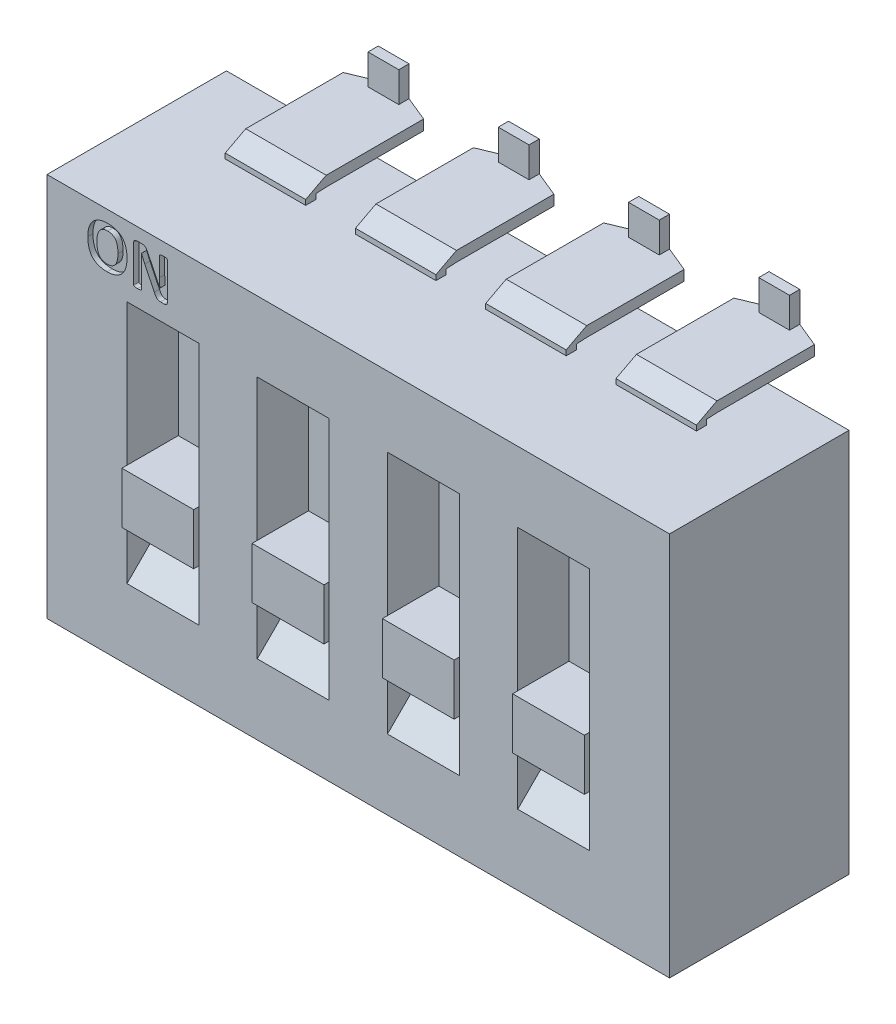
from build123d import *

# Parameters (mm, degrees)
SKETCH_1_W                         = 12.14
SKETCH_1_H                         = 7.5
EXTRUDE_1_DEPTH                    = 3.5
SKETCH_2_W                         = 1.57
SKETCH_2_H                         = 0.2
EXTRUDE_2_DEPTH                    = 0.1
SKETCH_3_W                         = 0.6
SKETCH_3_H                         = 0.79
EXTRUDE_3_DEPTH                    = 0.2
SKETCH_4_W                         = 1.57
SKETCH_4_H                         = 0.2
EXTRUDE_4_DEPTH                    = 1.9
CHAMFER_1_SIZE                     = 0.2
CHAMFER_1_SIZE_2                   = 0.485
LOFT_START                         = -4.595
LOFT_1_DEPTH                       = 1.57
SKETCH_5_W                         = 1.4
SKETCH_5_H                         = 2.76
CUT_EXTRUDE_1_DEPTH                = 1
CHAMFER_2_SIZE                     = 1
SKETCH_6_W                         = 1.4
SKETCH_6_H                         = 1
EXTRUDE_5_DEPTH                    = 1.1
PATTERN_LINEAR_3_COUNT             = 4
PATTERN_LINEAR_3_PITCH             = 2.54
CHAMFER_2_OF_PATTERN_LINEAR_3_SIZE = 1
PATTERN_LINEAR_1_COUNT             = 4
PATTERN_LINEAR_1_PITCH             = 2.54
CUT_EXTRUDE_2_DEPTH                = 0.1


# Read off the part's stored shape, not the designer's step: По сечениям1
# Some blends are built 0.0001 mm under size
with BuildPart() as part:
    # Эскиз1 → Бобышка-Вытянуть1 (new body)
    with BuildSketch(Plane.XY.offset(1)):
        Rectangle(SKETCH_1_W, SKETCH_1_H)
    extrude(amount=EXTRUDE_1_DEPTH)

    # Эскиз5 → Вырез-Вытянуть1 (cut)
    with BuildSketch(Plane.XY.offset(4.5)):
        with Locations((-3.81, 0)):
            Rectangle(SKETCH_5_W, SKETCH_5_H)
    cut_extrude_1 = extrude(amount=-CUT_EXTRUDE_1_DEPTH, mode=Mode.SUBTRACT)

    # Фаска2
    chamfer_2_edges = [part.edges().sort_by_distance(p)[0] for p in [
        (-3.81, 1.38, 4.5),
        (-3.81, -1.38, 4.5),
    ]]
    chamfer(chamfer_2_edges, length=CHAMFER_2_SIZE - 0.0001)  # a hair under: the kernel refuses the full size

    # Линейный массив3: Вырез-Вытянуть1 ×4
    with Locations(*[(i * PATTERN_LINEAR_3_PITCH, 0, 0) for i in range(1, PATTERN_LINEAR_3_COUNT)]):
        add(cut_extrude_1, mode=Mode.SUBTRACT)

    # Фаска2 of Линейный массив3
    chamfer_2_of_pattern_linear_3_edges = [part.edges().sort_by_distance(p)[0] for p in [
        (-1.27, 1.38, 4.5),
        (-1.27, -1.38, 4.5),
        (1.27, 1.38, 4.5),
        (1.27, -1.38, 4.5),
        (3.81, 1.38, 4.5),
        (3.81, -1.38, 4.5),
    ]]
    chamfer(chamfer_2_of_pattern_linear_3_edges, length=CHAMFER_2_OF_PATTERN_LINEAR_3_SIZE - 0.0001)  # a hair under: the kernel refuses the full size

    # Эскиз7 → Вырез-Вытянуть2 (cut)
    # profile 1 of 2: a face of its own
    with BuildSketch(Plane.XY.offset(4.5)):
        with BuildLine():
            add(Edge.make_bspline(
                [(-4.509391727, 3.114406517), (-4.509622839, 3.09833857), (-4.51007381, 3.066985037), (-4.51506288, 3.021352907), (-4.522587223, 2.97820318), (-4.533644408, 2.937811607), (-4.547521821, 2.900056251), (-4.564708226, 2.865335865), (-4.584790851, 2.833441889), (-4.608052203, 2.804631391), (-4.63433362, 2.778908939), (-4.663534795, 2.756318233), (-4.695820201, 2.737163106), (-4.730851229, 2.721121535), (-4.768808811, 2.708551981), (-4.809684942, 2.699892401), (-4.853363825, 2.694467856), (-4.883456068, 2.693795836), (-4.898913785, 2.693450635)],
                knots=[0, 0, 0, 0, 1.181067455, 2.304627813, 3.371397041, 4.398875488, 5.379772852, 6.324840374, 7.24235265, 8.145895775, 9.041233988, 9.940678369, 10.854054564, 11.795635534, 12.76881339, 13.787809768, 14.863646999, 16, 16, 16, 16], degree=3))
            add(Edge.make_bspline(
                [(-4.898913785, 2.693450635), (-4.914123191, 2.693695224), (-4.943635681, 2.694169828), (-4.986405306, 2.69890225), (-5.026251312, 2.706237255), (-5.063094954, 2.716913751), (-5.096983888, 2.730681087), (-5.127934522, 2.747734076), (-5.15613878, 2.767767928), (-5.181158165, 2.791401917), (-5.203198663, 2.818279435), (-5.222160132, 2.84855379), (-5.238433893, 2.882054508), (-5.251586167, 2.919062686), (-5.261868084, 2.959427147), (-5.268823177, 3.003304923), (-5.273344198, 3.050586252), (-5.273840894, 3.083329131), (-5.274097609, 3.100252106)],
                knots=[0, 0, 0, 0, 1.14605125, 2.223809784, 3.239278066, 4.196657126, 5.110123641, 5.990760065, 6.854667985, 7.710749604, 8.577135683, 9.46770869, 10.397275983, 11.379066547, 12.423123567, 13.532494508, 14.724683554, 16, 16, 16, 16], degree=3))
            add(Edge.make_bspline(
                [(-5.274097609, 3.100252106), (-5.27375784, 3.115948291), (-5.273094054, 3.146612985), (-5.268568599, 3.191388648), (-5.260588909, 3.233650326), (-5.24986277, 3.273503176), (-5.235902713, 3.310782702), (-5.218841717, 3.345258505), (-5.198640324, 3.376839804), (-5.175384725, 3.405446661), (-5.149164845, 3.431166247), (-5.119977857, 3.453682037), (-5.087827559, 3.472961786), (-5.052734738, 3.488936015), (-5.014691089, 3.501694575), (-4.973699991, 3.510567806), (-4.929818023, 3.515967778), (-4.899603947, 3.516635656), (-4.88402408, 3.516980047)],
                knots=[0, 0, 0, 0, 1.160914008, 2.268007866, 3.323978369, 4.338756358, 5.316875162, 6.263384146, 7.178594241, 8.083875972, 8.984426194, 9.889106488, 10.803912537, 11.750974708, 12.735550296, 13.765875032, 14.847975007, 16, 16, 16, 16], degree=3))
            add(Edge.make_bspline(
                [(-4.88402408, 3.516980047), (-4.869121351, 3.51673256), (-4.840159627, 3.516251598), (-4.7981177, 3.511537466), (-4.758808664, 3.504097585), (-4.722179526, 3.493695837), (-4.688334728, 3.480045608), (-4.657209409, 3.463389844), (-4.629153925, 3.443093784), (-4.604050056, 3.41955559), (-4.581556662, 3.392973068), (-4.562495643, 3.362836883), (-4.545962772, 3.329689538), (-4.532655302, 3.293090809), (-4.522214876, 3.253206005), (-4.514800145, 3.209974124), (-4.510108555, 3.163345896), (-4.509636022, 3.131085053), (-4.509391727, 3.114406517)],
                knots=[0, 0, 0, 0, 1.132472299, 2.200828589, 3.21116476, 4.170875335, 5.090315408, 5.980258557, 6.84769598, 7.714420291, 8.590505985, 9.487188694, 10.418317356, 11.401257481, 12.441795894, 13.548338263, 14.732515217, 16, 16, 16, 16], degree=3))
        make_face()
        with BuildLine():
            add(Edge.make_bspline(
                [(-4.685862315, 3.105582988), (-4.685949344, 3.115941269), (-4.686119428, 3.136184957), (-4.687994754, 3.165813957), (-4.691065573, 3.193981468), (-4.695474186, 3.220615703), (-4.701012401, 3.245764923), (-4.708475159, 3.269051244), (-4.717796638, 3.29043327), (-4.728544016, 3.310035588), (-4.74132552, 3.327688896), (-4.756095508, 3.343297204), (-4.773042847, 3.356539199), (-4.791745583, 3.367985536), (-4.812824745, 3.376791597), (-4.836201781, 3.383290944), (-4.862102449, 3.386833217), (-4.880153569, 3.387316837), (-4.889538785, 3.387568282)],
                knots=[0, 0, 0, 0, 1.248306964, 2.439626501, 3.576526119, 4.66195957, 5.692118455, 6.677712867, 7.603820791, 8.499754584, 9.366886977, 10.223578091, 11.080555655, 11.951954716, 12.85865995, 13.824437323, 14.868871972, 16, 16, 16, 16], degree=3))
            add(Edge.make_bspline(
                [(-4.889538785, 3.387568282), (-4.89905326, 3.387296268), (-4.917325574, 3.386773871), (-4.943587402, 3.382509678), (-4.967435375, 3.375439426), (-4.988849351, 3.365369377), (-5.007846555, 3.352903373), (-5.024987462, 3.338635407), (-5.040113589, 3.322338814), (-5.05334257, 3.304217843), (-5.064919233, 3.284449141), (-5.074044829, 3.262757103), (-5.082196974, 3.239766724), (-5.08779168, 3.21510725), (-5.092201901, 3.189446493), (-5.095219011, 3.162927318), (-5.097423215, 3.13570587), (-5.097558542, 3.117291074), (-5.097627021, 3.107972694)],
                knots=[0, 0, 0, 0, 1.153225958, 2.214741912, 3.216094119, 4.16009031, 5.073077605, 5.964494141, 6.858230186, 7.761795903, 8.68066018, 9.629003448, 10.611206296, 11.634860154, 12.690273443, 13.767663655, 14.870377893, 16, 16, 16, 16], degree=3))
            add(Edge.make_bspline(
                [(-5.097627021, 3.107972694), (-5.097537329, 3.097247364), (-5.097362416, 3.076331346), (-5.095539358, 3.045837425), (-5.092328632, 3.017029), (-5.088348101, 2.98982565), (-5.082418087, 2.964468591), (-5.075150042, 2.940836387), (-5.065922323, 2.91921986), (-5.055363544, 2.899339669), (-5.042717557, 2.881590765), (-5.028001353, 2.866095585), (-5.011149968, 2.852921711), (-4.992497553, 2.841695964), (-4.971269538, 2.833191633), (-4.947706864, 2.827295827), (-4.921642733, 2.823538907), (-4.90346197, 2.823094759), (-4.89395055, 2.8228624)],
                knots=[0, 0, 0, 0, 1.279653928, 2.495518946, 3.642823718, 4.737874749, 5.773595616, 6.747088542, 7.68406817, 8.573908718, 9.428072391, 10.276175527, 11.114292987, 11.973199623, 12.865200127, 13.831639063, 14.865603682, 16, 16, 16, 16], degree=3))
            add(Edge.make_bspline(
                [(-4.89395055, 2.8228624), (-4.884435658, 2.823131966), (-4.866162543, 2.823649662), (-4.839981775, 2.827933999), (-4.816209879, 2.834849938), (-4.794769927, 2.844652999), (-4.775829901, 2.857239099), (-4.758442564, 2.871360652), (-4.743399141, 2.887937674), (-4.730063055, 2.906232867), (-4.718685689, 2.926376658), (-4.709109202, 2.948183291), (-4.701407884, 2.971586132), (-4.695648073, 2.996474585), (-4.691283721, 3.022519238), (-4.688270181, 3.049525911), (-4.686066533, 3.07729924), (-4.685930923, 3.096080931), (-4.685862315, 3.105582988)],
                knots=[0, 0, 0, 0, 1.144095152, 2.197206425, 3.181453363, 4.114866049, 5.020624657, 5.910648687, 6.802715632, 7.705078328, 8.629453105, 9.579998293, 10.566037856, 11.588758084, 12.650348858, 13.741173613, 14.857211693, 16, 16, 16, 16], degree=3))
        make_face(mode=Mode.SUBTRACT)
    # profile 2 of 2: a face of its own
    with BuildSketch(Plane.XY.offset(4.5)):
        with BuildLine():
            add(Edge.make_bspline(
                [(-3.721156432, 2.763119753), (-3.721374728, 2.758612748), (-3.721796356, 2.749907669), (-3.725823596, 2.737842819), (-3.731743463, 2.727477818), (-3.73965669, 2.719050247), (-3.749218983, 2.712452067), (-3.760260214, 2.70817418), (-3.77204036, 2.705853795), (-3.780031853, 2.705428034), (-3.78402408, 2.705215341)],
                knots=[0, 0, 0, 0, 1.120032347, 2.163292293, 3.135130692, 4.07524891, 5.019946156, 6.00690811, 7.004331812, 8, 8, 8, 8], degree=3))
            Line((-3.78402408, 2.705215341), (-3.855347609, 2.705215341))
            add(Edge.make_bspline(
                [(-3.855347609, 2.705215341), (-3.862282127, 2.705407038), (-3.875202148, 2.705764197), (-3.893598369, 2.708908321), (-3.909860097, 2.715588557), (-3.924588191, 2.725921774), (-3.938179441, 2.740194162), (-3.951084948, 2.758752273), (-3.964112297, 2.782004329), (-3.972596888, 2.799286116), (-3.977222609, 2.808707988)],
                knots=[0, 0, 0, 0, 0.966254035, 1.800272596, 2.585200708, 3.395271146, 4.288963202, 5.317323791, 6.537429596, 8, 8, 8, 8], degree=3))
            Line((-3.977222609, 2.808707988), (-4.163803491, 3.190325635))
            add(Edge.make_bspline(
                [(-4.163803491, 3.190325635), (-4.169299131, 3.20207089), (-4.180666822, 3.226365867), (-4.1971507, 3.263738342), (-4.212687967, 3.302088435), (-4.222315977, 3.327865222), (-4.227038785, 3.340509459)],
                knots=[0, 0, 0, 0, 0.954558477, 1.974497353, 3.006434174, 4, 4, 4, 4], degree=3))
            Line((-4.227038785, 3.340509459), (-4.22832555, 3.340509459))
            add(Edge.make_bspline(
                [(-4.22832555, 3.340509459), (-4.22797875, 3.325436594), (-4.22728662, 3.295354736), (-4.226971984, 3.250068654), (-4.227056203, 3.204173708), (-4.227044652, 3.173291333), (-4.227038785, 3.157605047)],
                knots=[0, 0, 0, 0, 0.989090355, 1.973989423, 2.970915262, 4, 4, 4, 4], degree=3))
            Line((-4.227038785, 3.157605047), (-4.227038785, 2.7322374))
            add(Edge.make_bspline(
                [(-4.227038785, 2.7322374), (-4.227224359, 2.730248748), (-4.227602112, 2.726200666), (-4.230509697, 2.720473847), (-4.235753763, 2.715623762), (-4.243440576, 2.711813574), (-4.253937235, 2.709066041), (-4.267440999, 2.706614712), (-4.284684664, 2.705577797), (-4.297382257, 2.705344695), (-4.304428491, 2.705215341)],
                knots=[0, 0, 0, 0, 0.533239368, 1.085457576, 1.679302583, 2.423102222, 3.366158425, 4.586936804, 6.105999776, 8, 8, 8, 8], degree=3))
            add(Edge.make_bspline(
                [(-4.304428491, 2.705215341), (-4.311291345, 2.705341421), (-4.323805811, 2.705571328), (-4.340789889, 2.7066652), (-4.354239342, 2.708892428), (-4.364629492, 2.711521614), (-4.371958913, 2.715519421), (-4.377116018, 2.720050463), (-4.379586976, 2.725778495), (-4.379848329, 2.729707202), (-4.379979962, 2.731685929)],
                knots=[0, 0, 0, 0, 1.880338663, 3.428811631, 4.65383513, 5.615149483, 6.343797838, 6.92541045, 7.458773589, 8, 8, 8, 8], degree=3))
            Line((-4.379979962, 2.731685929), (-4.379979962, 3.447310929))
            add(Edge.make_bspline(
                [(-4.379979962, 3.447310929), (-4.37979654, 3.451868972), (-4.379448868, 3.460508657), (-4.376091252, 3.472572825), (-4.370514634, 3.482878622), (-4.362507044, 3.491005267), (-4.353158016, 3.497503095), (-4.342448391, 3.501824264), (-4.330931564, 3.504744296), (-4.322891197, 3.505055634), (-4.318766727, 3.505215341)],
                knots=[0, 0, 0, 0, 1.146599659, 2.173358234, 3.127386818, 4.066803063, 5.022080866, 5.977233821, 6.962380843, 8, 8, 8, 8], degree=3))
            Line((-4.318766727, 3.505215341), (-4.227957903, 3.505215341))
            add(Edge.make_bspline(
                [(-4.227957903, 3.505215341), (-4.220404175, 3.505121007), (-4.206565733, 3.504948187), (-4.18741683, 3.501714911), (-4.170822109, 3.49665391), (-4.156340104, 3.488222876), (-4.143118388, 3.476844051), (-4.131149481, 3.46188675), (-4.119732448, 3.443414978), (-4.11299759, 3.429550297), (-4.109391727, 3.422127106)],
                knots=[0, 0, 0, 0, 1.157819279, 2.121126641, 2.971782284, 3.805898374, 4.67303314, 5.635237899, 6.733899397, 8, 8, 8, 8], degree=3))
            Line((-4.109391727, 3.422127106), (-3.963987315, 3.131134459))
            add(Edge.make_bspline(
                [(-3.963987315, 3.131134459), (-3.959747155, 3.122378051), (-3.951362181, 3.105062133), (-3.939070249, 3.079134106), (-3.926577001, 3.053692078), (-3.914974427, 3.028156467), (-3.903533654, 3.002992379), (-3.892511118, 2.978084018), (-3.881605963, 2.953416266), (-3.874513826, 2.936961086), (-3.870972609, 2.928744753)],
                knots=[0, 0, 0, 0, 1.048159491, 2.072750013, 3.091389825, 4.101587992, 5.094292605, 6.069547355, 7.0360943, 8, 8, 8, 8], degree=3))
            add(Edge.make_bspline(
                [(-3.870972609, 2.928744753), (-3.871019642, 2.943326603), (-3.872241532, 2.973096578), (-3.873198617, 3.018080206), (-3.874033787, 3.062932861), (-3.87407669, 3.092592389), (-3.874097609, 3.107053576)],
                knots=[0, 0, 0, 0, 0.981864332, 2.004551901, 3.027073275, 4, 4, 4, 4], degree=3))
            Line((-3.874097609, 3.107053576), (-3.874097609, 3.478928576))
            add(Edge.make_bspline(
                [(-3.874097609, 3.478928576), (-3.873934264, 3.480867991), (-3.873603162, 3.484799221), (-3.870274053, 3.490266873), (-3.864761092, 3.494971952), (-3.856787957, 3.4989791), (-3.846085571, 3.502013044), (-3.832359284, 3.503816476), (-3.815177451, 3.505137797), (-3.802471447, 3.505187668), (-3.795421138, 3.505215341)],
                knots=[0, 0, 0, 0, 0.513514522, 1.040903369, 1.654763982, 2.430140109, 3.402872071, 4.610164628, 6.119047709, 8, 8, 8, 8], degree=3))
            add(Edge.make_bspline(
                [(-3.795421138, 3.505215341), (-3.788676861, 3.505186494), (-3.776398787, 3.505133979), (-3.759711134, 3.503791894), (-3.74639132, 3.502080744), (-3.736260892, 3.499045702), (-3.729075557, 3.494949704), (-3.724361447, 3.490128798), (-3.721455742, 3.484671839), (-3.721257185, 3.480739917), (-3.721156432, 3.478744753)],
                knots=[0, 0, 0, 0, 1.872486456, 3.408893843, 4.648537669, 5.595853804, 6.328496016, 6.918324485, 7.451128226, 8, 8, 8, 8], degree=3))
            Line((-3.721156432, 3.478744753), (-3.721156432, 2.763119753))
        make_face()
    extrude(amount=-CUT_EXTRUDE_2_DEPTH, mode=Mode.SUBTRACT)


with BuildPart() as body_2:
    # Эскиз2 → Бобышка-Вытянуть2 (new body)
    with BuildSketch(Plane.XZ.offset(3.75)):
        with Locations((-3.81, 2.4)):
            Rectangle(SKETCH_2_W, SKETCH_2_H)
    extrude(amount=EXTRUDE_2_DEPTH)



with BuildPart() as body_3:
    # Эскиз3 → Бобышка-Вытянуть3 (new body)
    with BuildSketch(Plane.XY):
        with Locations((-3.81, -4.255)):
            Rectangle(SKETCH_3_W, SKETCH_3_H)
    extrude(amount=EXTRUDE_3_DEPTH)

    # Эскиз4 → Бобышка-Вытянуть4 (add)
    with BuildSketch(Plane.XY.offset(0.2)):
        with Locations((-3.81, -3.96)):
            Rectangle(SKETCH_4_W, SKETCH_4_H)
    extrude(amount=EXTRUDE_4_DEPTH)

    # Фаска1
    # the kernel refuses this chamfer: 0.485, 0.2 mm, written as the material it adds along each edge
    with BuildSketch(Plane(origin=(-3.51, -3.86, 0.2), x_dir=(-0.08615522911587765, 0, -0.9962817254652374), z_dir=(0, -1, 0)), Plane(origin=(-4.11, -4.06, 0.2), x_dir=(0.08615522911587978, 0, -0.9962817254652372), z_dir=(0, 1, 0))) as chamfer_1_piece_1:
        Polygon((CHAMFER_1_SIZE * 0.996281725465, CHAMFER_1_SIZE * 0.0861552291159), (-CHAMFER_1_SIZE_2 * 0.0861552291159, CHAMFER_1_SIZE_2 * 0.996281725465), (0, 0), align=None)
    extrude(amount=0.2)


with BuildPart() as body_2_1:
    add(body_2.part)

    add(body_3.part)  # По сечениям1 merges body 3
    # По сечениям1 outline → По сечениям1 (add)
    with BuildSketch(Plane.YZ.offset(LOFT_START)):
        Polygon((-3.85, 2.3), (-3.85, 2.5), (-4.06, 2.1), (-3.86, 2.1), align=None)
    extrude(amount=LOFT_1_DEPTH)


with BuildPart() as body_3_2:
    # Эскиз6 → Бобышка-Вытянуть5 (new body)
    with BuildSketch(Plane.XY.offset(3.5)):
        with Locations((-3.81, -0.88)):
            Rectangle(SKETCH_6_W, SKETCH_6_H)
    extrude(amount=EXTRUDE_5_DEPTH)


with BuildPart() as body_4:
    # Зеркальное отражение1: mirrored copy
    add(body_2_1.part.mirror(Plane.ZX))


with BuildPart() as pattern_linear_1_1:
    # Линейный массив1: pattern copy
    add(body_4.part.moved(Location(Vector(1, 0, 0) * (1 * PATTERN_LINEAR_1_PITCH))))


with BuildPart() as pattern_linear_1_2:
    # Линейный массив1: pattern copy
    add(body_4.part.moved(Location(Vector(1, 0, 0) * (2 * PATTERN_LINEAR_1_PITCH))))


with BuildPart() as pattern_linear_1_3:
    # Линейный массив1: pattern copy
    add(body_4.part.moved(Location(Vector(1, 0, 0) * (3 * PATTERN_LINEAR_1_PITCH))))


with BuildPart() as pattern_linear_1_4:
    # Линейный массив1: pattern copy
    add(body_2_1.part.moved(Location(Vector(1, 0, 0) * (1 * PATTERN_LINEAR_1_PITCH))))


with BuildPart() as pattern_linear_1_5:
    # Линейный массив1: pattern copy
    add(body_2_1.part.moved(Location(Vector(1, 0, 0) * (2 * PATTERN_LINEAR_1_PITCH))))


with BuildPart() as pattern_linear_1_6:
    # Линейный массив1: pattern copy
    add(body_2_1.part.moved(Location(Vector(1, 0, 0) * (3 * PATTERN_LINEAR_1_PITCH))))


with BuildPart() as pattern_linear_1_7:
    # Линейный массив1: pattern copy
    add(body_3_2.part.moved(Location(Vector(1, 0, 0) * (1 * PATTERN_LINEAR_1_PITCH))))


with BuildPart() as pattern_linear_1_8:
    # Линейный массив1: pattern copy
    add(body_3_2.part.moved(Location(Vector(1, 0, 0) * (2 * PATTERN_LINEAR_1_PITCH))))


with BuildPart() as pattern_linear_1_9:
    # Линейный массив1: pattern copy
    add(body_3_2.part.moved(Location(Vector(1, 0, 0) * (3 * PATTERN_LINEAR_1_PITCH))))


solid = Compound([part.part, body_2_1.part, body_3_2.part, body_4.part, pattern_linear_1_1.part, pattern_linear_1_2.part, pattern_linear_1_3.part, pattern_linear_1_4.part, pattern_linear_1_5.part, pattern_linear_1_6.part, pattern_linear_1_7.part, pattern_linear_1_8.part, pattern_linear_1_9.part])
